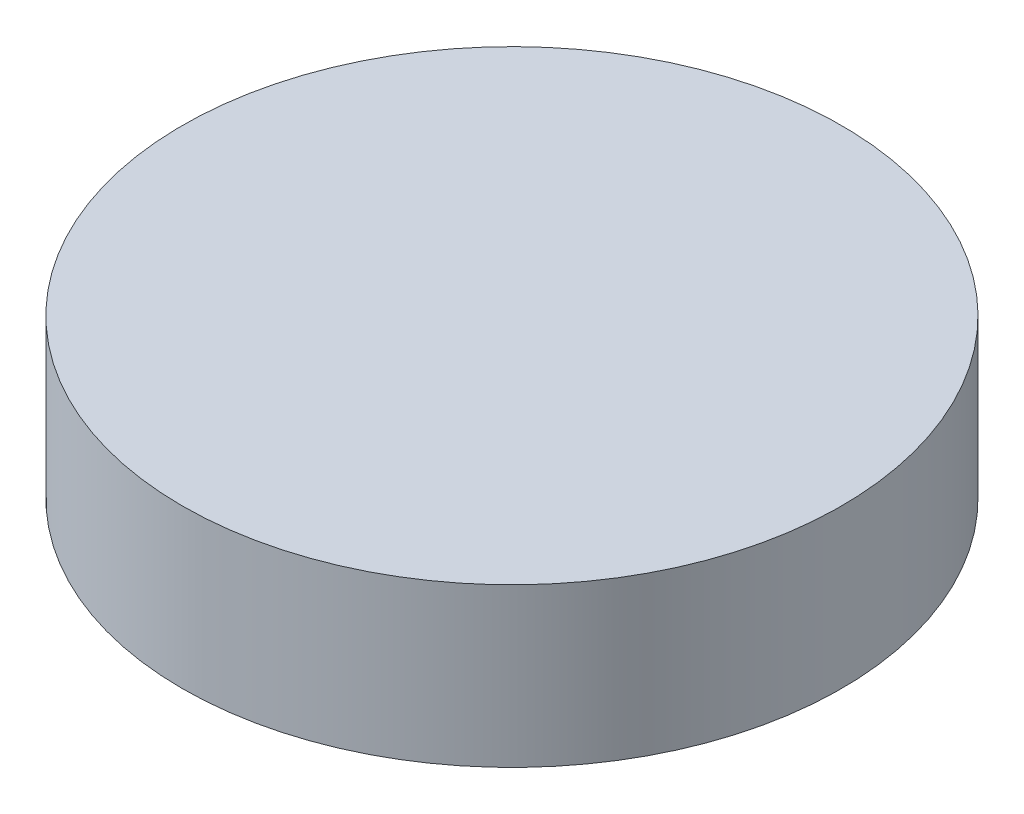
from build123d import *

# Parameters (mm, degrees)
SKETCH1_R           = 6.25
BOSS_EXTRUDE1_DEPTH = 3


with BuildPart() as part:
    # Sketch1 → Boss-Extrude1 (new body)
    with BuildSketch(Plane(origin=(0, 0, 0), x_dir=(1, 0, 0), z_dir=(0, 1, 0))):
        Circle(SKETCH1_R)
    extrude(amount=BOSS_EXTRUDE1_DEPTH)


solid = part.part
